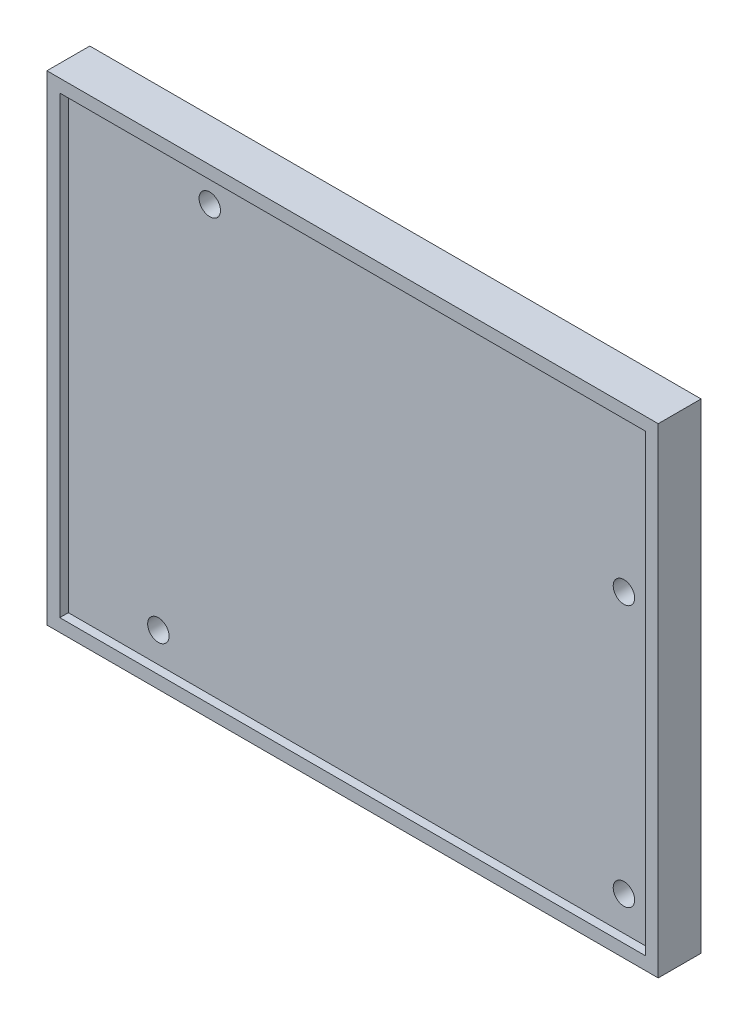
from build123d import *

# Parameters (mm, degrees)
SKETCH1_W           = 71.31
SKETCH1_H           = 56
BOSS_EXTRUDE1_DEPTH = 5
SKETCH2_R           = 1.25
CUT_EXTRUDE1_DEPTH  = 5
SKETCH3_W           = 68.31
SKETCH3_H           = 53
CUT_EXTRUDE2_DEPTH  = 1


with BuildPart() as part:
    # Sketch1 → Boss-Extrude1 (new body)
    with BuildSketch(Plane.XY):
        Rectangle(SKETCH1_W, SKETCH1_H)
    extrude(amount=BOSS_EXTRUDE1_DEPTH)

    # Sketch2 → Cut-Extrude1 (cut)
    with BuildSketch(Plane.XY.offset(5)):
        with Locations((-23.655, -23)):
            Circle(SKETCH2_R)
        with Locations((30.655, 8)):
            Circle(SKETCH2_R)
        with Locations((-17.655, 23)):
            Circle(SKETCH2_R)
        with Locations((30.655, -22.5)):
            Circle(SKETCH2_R)
    extrude(amount=-CUT_EXTRUDE1_DEPTH, mode=Mode.SUBTRACT)

    # Sketch3 → Cut-Extrude2 (cut)
    with BuildSketch(Plane.XY.offset(5)):
        Rectangle(SKETCH3_W, SKETCH3_H)
    extrude(amount=-CUT_EXTRUDE2_DEPTH, mode=Mode.SUBTRACT)


solid = part.part
